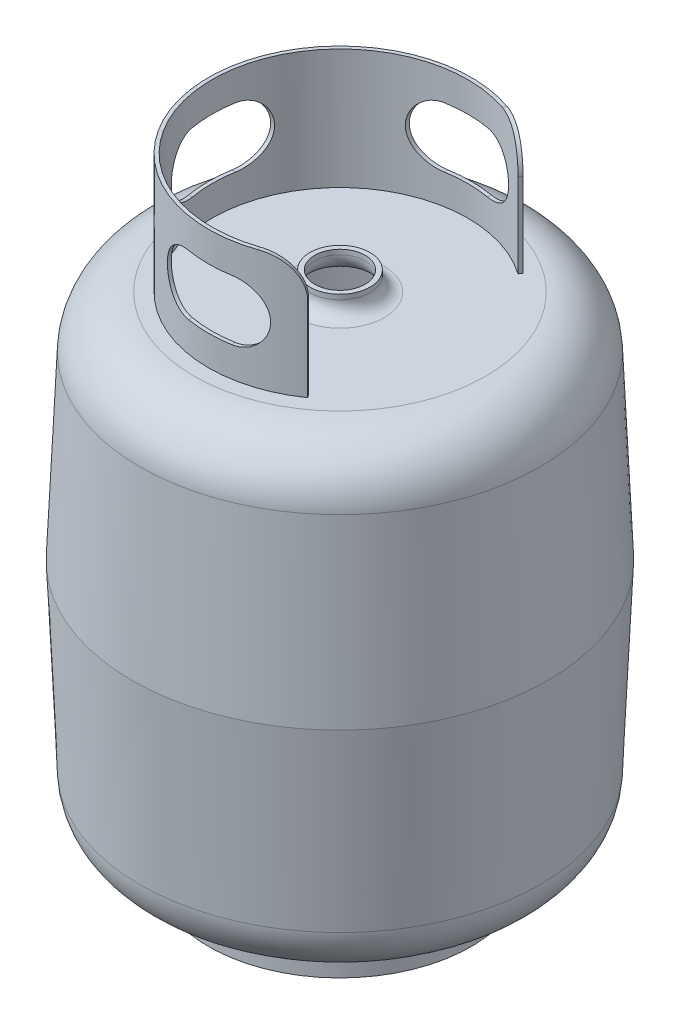
from build123d import *

# Parameters (mm, degrees)
SKETCH6_R           = 109.539022915
SKETCH6_R_2         = 106.539022915
BOSS_EXTRUDE3_DEPTH = 30
BOSS_EXTRUDE4_START = 100
BOSS_EXTRUDE4_DEPTH = 100
CUT_EXTRUDE4_DEPTH  = 383.361064733
CIRPATTERN3_COUNT   = 3
CIRPATTERN3_ANGLE   = 180
FILLET4_R           = 30


with BuildPart() as part:
    # Sketch1 → Revolve1 (revolve)
    with BuildSketch(Plane.XY, mode=Mode.PRIVATE) as revolve1_sk:
        with BuildLine():
            Line((0, -193.75), (-121.539022915, -193.75))
            ThreePointArc((-121.539022915, -193.75), (-152.657110425, -181.256378293), (-166.496192886, -150.712872431))
            Line((-166.496192886, -150.712872431), (-173.076459005, 0))
            Line((-173.076459005, 0), (-166.496192886, 150.712872431))
            ThreePointArc((-166.496192886, 150.712872431), (-152.657110425, 181.256378293), (-121.539022915, 193.75))
            Line((-121.539022915, 193.75), (-37, 193.75))
            ThreePointArc((-37, 193.75), (-28.514718626, 197.264718626), (-25, 205.75))
            Line((-25, 205.75), (-25, 209.75))
            Line((-25, 209.75), (-21, 209.75))
            Line((-21, 209.75), (-21, 205.75))
            ThreePointArc((-21, 205.75), (-25.686291501, 194.436291501), (-37, 189.75))
            Line((-37, 189.75), (-121.539022915, 189.75))
            ThreePointArc((-121.539022915, 189.75), (-149.891058202, 178.366922444), (-162.5, 150.538394882))
            Line((-162.5, 150.538394882), (-169.072648264, 0))
            Line((-169.072648264, 0), (-162.5, -150.538394882))
            ThreePointArc((-162.5, -150.538394882), (-149.891058202, -178.366922444), (-121.539022915, -189.75))
            Line((-121.539022915, -189.75), (0, -189.75))
            Line((0, -189.75), (0, -193.75))
        make_face()
    revolve(revolve1_sk.sketch.rotate(Axis((0, 287.611580139, 0), (0, -1, 0)), 270), axis=Axis((0, 287.611580139, 0), (0, -1, 0)))

    # Sketch6 → Boss-Extrude3 (add)
    with BuildSketch(Plane.XZ.offset(193.75)):
        with Locations(Location((0, 0, 0), (0, 0, 270))):
            Circle(SKETCH6_R)
        with Locations(Location((0, 0, 0), (0, 0, 270))):
            Circle(SKETCH6_R_2, mode=Mode.SUBTRACT)
    extrude(amount=BOSS_EXTRUDE3_DEPTH)

    # Sketch7 → Boss-Extrude4 (add)
    with BuildSketch(Plane(origin=(0, 193.75, 0), x_dir=(1, 0, 0), z_dir=(0, 1, 0)).offset(BOSS_EXTRUDE4_START)):
        with BuildLine():
            Line((62.829002405, 89.72911455), (61.108273096, 87.271658417))
            ThreePointArc((61.108273096, 87.271658417), (-106.539022915, 0), (61.108273096, -87.271658417))
            Line((61.108273096, -87.271658417), (62.829002405, -89.72911455))
            ThreePointArc((62.829002405, -89.72911455), (-109.539022915, 0), (62.829002405, 89.72911455))
        make_face()
    extrude(amount=-BOSS_EXTRUDE4_DEPTH)

    # Sketch8 → Cut-Extrude4 (cut, through all)
    with BuildSketch(Plane.XY):
        with BuildLine():
            Line((-18, 268.75), (18, 268.75))
            ThreePointArc((18, 268.75), (43, 243.75), (18, 218.75))
            Line((18, 218.75), (-18, 218.75))
            ThreePointArc((-18, 218.75), (-43, 243.75), (-18, 268.75))
        make_face()
    cut_extrude4 = extrude(amount=-CUT_EXTRUDE4_DEPTH, mode=Mode.SUBTRACT)

    # CirPattern3: Cut-Extrude4 ×3 about axis
    cirpattern3_axis = Axis((0, 293.75, 0), (0, 1, 0))
    for i in range(1, CIRPATTERN3_COUNT):
        add(cut_extrude4.rotate(cirpattern3_axis, i * CIRPATTERN3_ANGLE / (CIRPATTERN3_COUNT - 1)), mode=Mode.SUBTRACT)

    # Fillet4
    # the kernel refuses this fillet: 30 mm, written as the material it takes off along each edge
    with BuildSketch(Plane(origin=(105.847235131, 293.75, -151.165517872), x_dir=(0, -1, 0), z_dir=(-0.5735764363510459, 0, 0.8191520442889919))) as fillet4_piece_1_section:
        with BuildLine():
            CenterArc((FILLET4_R, -FILLET4_R), FILLET4_R, 90, 90)
            Line((0, -FILLET4_R), (-FILLET4_R * 0.02, -FILLET4_R))
            Line((-FILLET4_R * 0.02, -FILLET4_R), (-FILLET4_R * 0.02, FILLET4_R * 0.02))
            Line((-FILLET4_R * 0.02, FILLET4_R * 0.02), (FILLET4_R, FILLET4_R * 0.02))
            Line((FILLET4_R, FILLET4_R * 0.02), (FILLET4_R, 0))
        make_face()
    fillet4_piece_1 = extrude(amount=153, mode=Mode.PRIVATE)
    fillet4_piece_1 = fillet4_piece_1 & Plane(origin=(0, 286.977379122, 0), x_dir=(0.5735764363510502, 0, 0.8191520442889889), z_dir=(0, 1, 0)) * Cylinder(109.539022915, 426, mode=Mode.PRIVATE)
    fillet4_piece_1 = fillet4_piece_1 - Plane(origin=(0, 286.977379122, 0), x_dir=(0.5735764363510502, 0, -0.8191520442889889), z_dir=(0, 1, 0)) * Cylinder(106.539022915, 426, mode=Mode.PRIVATE)
    add(fillet4_piece_1, mode=Mode.SUBTRACT)
    with BuildSketch(Plane(origin=(18.09004037, 293.75, 25.835255096), x_dir=(0, -1, 0), z_dir=(0.5735764363510459, 0, 0.8191520442889919))) as fillet4_piece_2_section:
        with BuildLine():
            CenterArc((FILLET4_R, -FILLET4_R), FILLET4_R, 90, 90)
            Line((0, -FILLET4_R), (-FILLET4_R * 0.02, -FILLET4_R))
            Line((-FILLET4_R * 0.02, -FILLET4_R), (-FILLET4_R * 0.02, FILLET4_R * 0.02))
            Line((-FILLET4_R * 0.02, FILLET4_R * 0.02), (FILLET4_R, FILLET4_R * 0.02))
            Line((FILLET4_R, FILLET4_R * 0.02), (FILLET4_R, 0))
        make_face()
    fillet4_piece_2 = extrude(amount=153, mode=Mode.PRIVATE)
    fillet4_piece_2 = fillet4_piece_2 - Plane(origin=(0, 286.97733052, 0), x_dir=(0.5735764363510502, 0, -0.8191520442889889), z_dir=(0, 1, 0)) * Cylinder(106.539022915, 427, mode=Mode.PRIVATE)
    fillet4_piece_2 = fillet4_piece_2 & Plane(origin=(0, 286.97733052, 0), x_dir=(0.5735764363510502, 0, 0.8191520442889889), z_dir=(0, 1, 0)) * Cylinder(109.539022915, 427, mode=Mode.PRIVATE)
    add(fillet4_piece_2, mode=Mode.SUBTRACT)


solid = part.part
